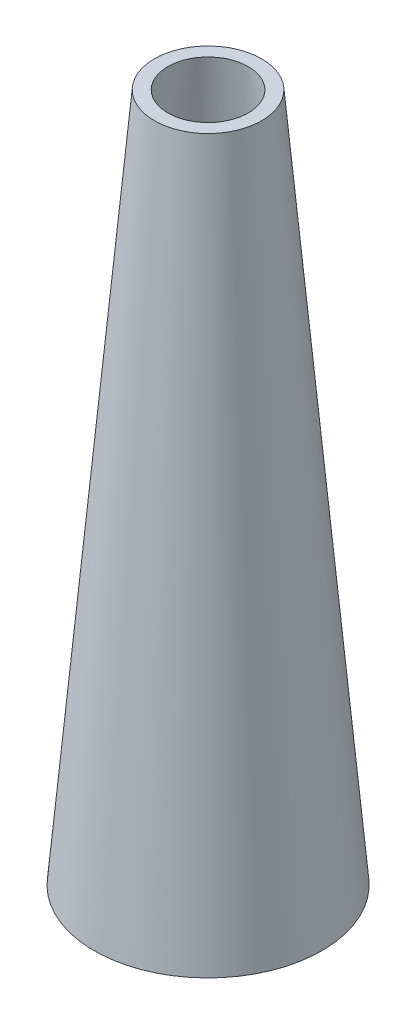
from build123d import *


with BuildPart() as part:
    # Sketch1 → Revolve1 (revolve)
    with BuildSketch(Plane.XY):
        Polygon((9.525, 43.334805302), (12.712127984, 43.334805302), (26.9875, -119.83344348), (23.800372016, -119.83344348), align=None)
    revolve(axis=Axis((0, 0, 0), (0, 1, 0)))


solid = part.part
